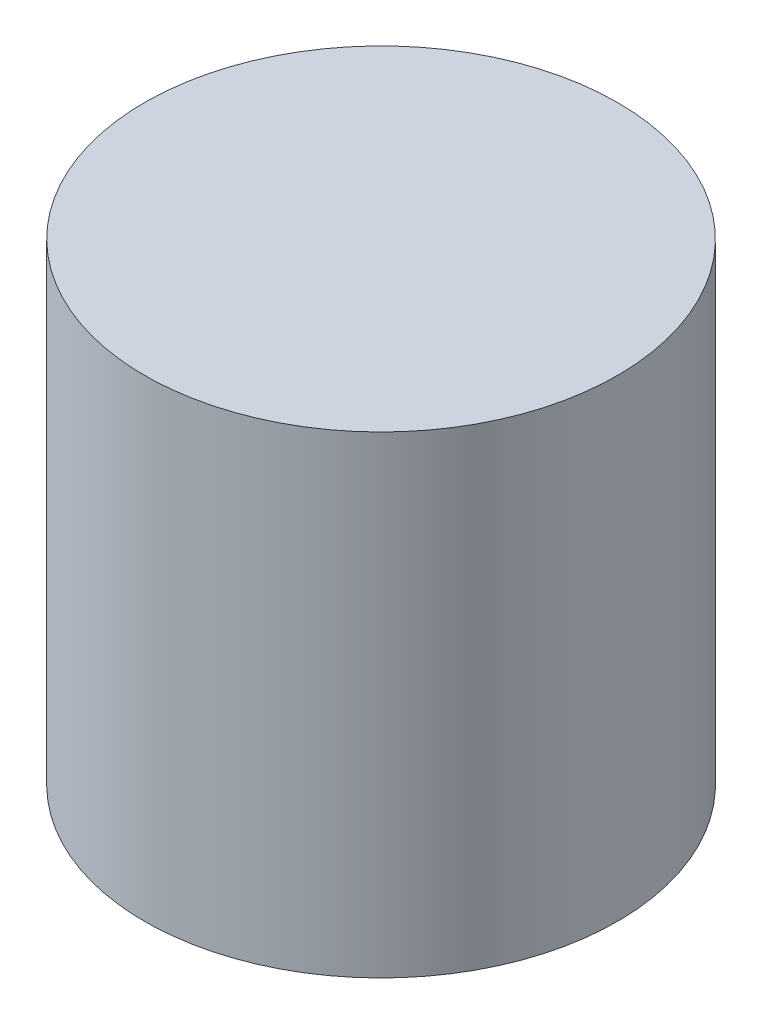
from build123d import *

# Parameters (mm, degrees)
SKETCH1_W           = 203.69051182
SKETCH1_H           = 2
BASE_EXTRUDE_DEPTH  = 60
SKETCH3_R           = 1
BOSS_EXTRUDE1_DEPTH = 2
SKETCH4_W           = 120
SKETCH4_H           = 2
CUT_EXTRUDE1_DEPTH  = 213.35306592


with BuildPart() as part:
    # Sketch1 → Base-Extrude (new, symmetric)
    with BuildSketch(Plane.XY):
        with Locations((0, 1)):
            Rectangle(SKETCH1_W, SKETCH1_H)
    extrude(amount=BASE_EXTRUDE_DEPTH, both=True)

    # Sketch3 → Boss-Extrude1 (add)
    with BuildSketch(Plane.XZ):
        Circle(SKETCH3_R)
    extrude(amount=BOSS_EXTRUDE1_DEPTH)

    # Sketch4 → Cut-Extrude1 (cut, through all)
    with BuildSketch(Plane(origin=(101.84525591, 0, 0), x_dir=(0, 0, -1), z_dir=(1, 0, 0))):
        with Locations((0, 1)):
            Rectangle(SKETCH4_W, SKETCH4_H)
    extrude(amount=-CUT_EXTRUDE1_DEPTH, mode=Mode.SUBTRACT)


solid = part.part
